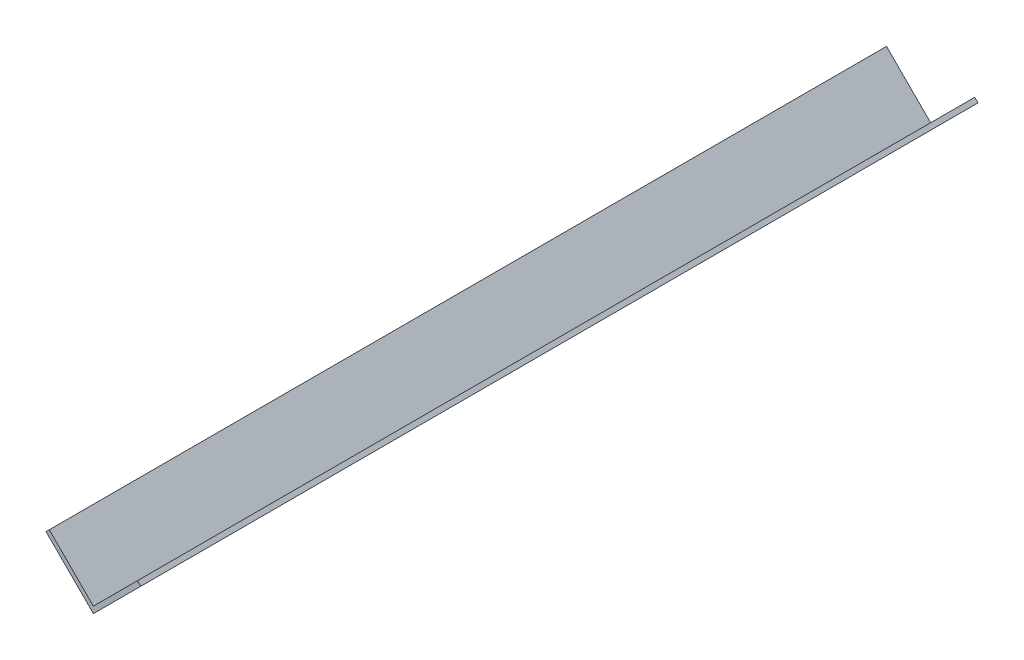
from build123d import *

# Parameters (mm, degrees)
BOSS_EXTRUDE1_DEPTH = 317.5


with BuildPart() as part:
    # Sketch1 → Boss-Extrude1 (new body)
    with BuildSketch(Plane.XY):
        Polygon((0, 0), (-17.960512242, 17.960512242), (-16.725727025, 19.195297459), (0, 2.469570433), (16.725727025, 19.195297459), (17.960512242, 17.960512242), align=None)
    extrude(amount=BOSS_EXTRUDE1_DEPTH)


solid = part.part
